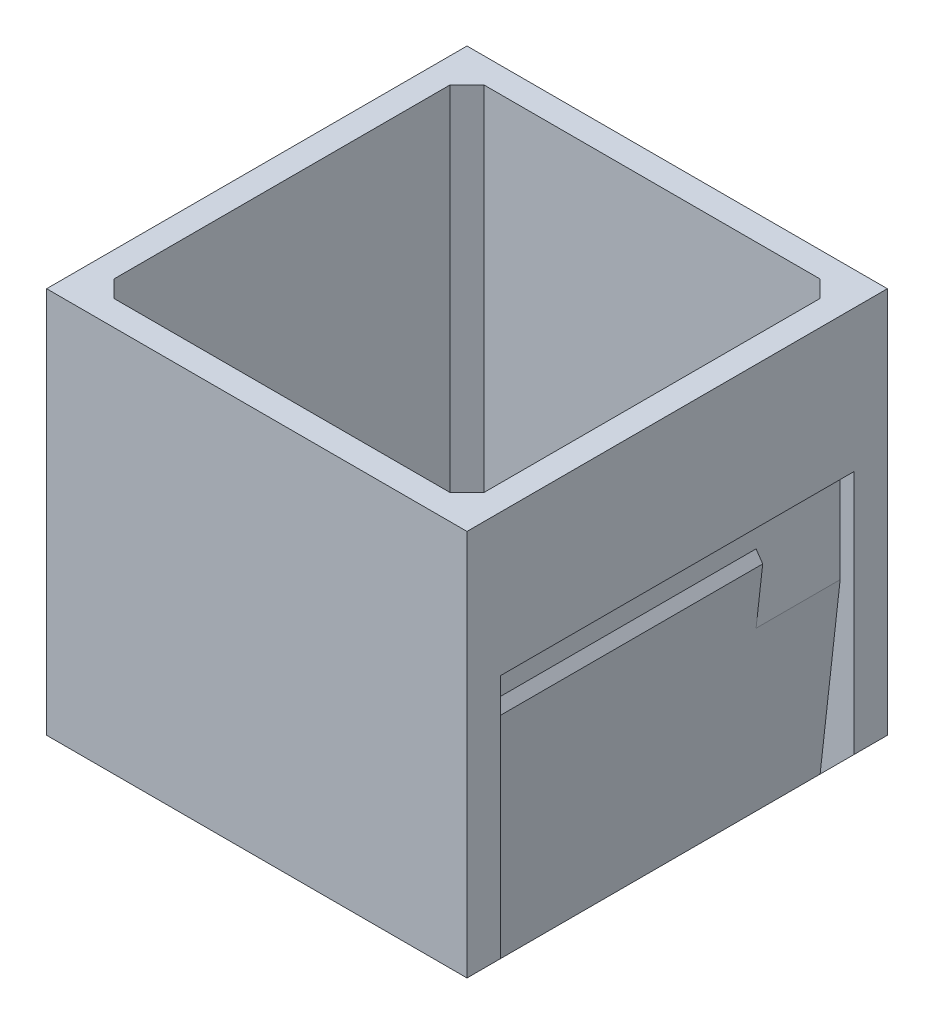
from build123d import *

# Parameters (mm, degrees)
SKIZZE1_W                       = 25
SKIZZE1_H                       = 25
AUFSATZ_LINEAR_AUSTRAGEN1_DEPTH = 25
FASE1_SIZE                      = 2
SCHNITT_LINEAR_START            = -2
SCHNITT_LINEAR_AUSTRAGEN1_DEPTH = 21
WANDUNG1_START                  = -11
WANDUNG1_DEPTH                  = 22
WANDUNG1_START_2                = -12
WANDUNG1_2_DEPTH                = 22
FASE2_SIZE                      = 1
SCHNITT_LINEAR_AUSTRAGEN2_DEPTH = 5


with BuildPart() as part:
    # Skizze1 → Aufsatz-Linear austragen1 (new body)
    with BuildSketch(Plane(origin=(0, 0, 0), x_dir=(1, 0, 0), z_dir=(0, 1, 0))):
        Rectangle(SKIZZE1_W, SKIZZE1_H)
    extrude(amount=AUFSATZ_LINEAR_AUSTRAGEN1_DEPTH)

    # Fase1
    fase1_edges = [part.edges().sort_by_distance(p)[0] for p in [
        (0, 0, 12.5),
        (-12.5, 0, 0),
        (0, 0, -12.5),
        (12.5, 0, 0),
    ]]
    chamfer(fase1_edges, length=FASE1_SIZE)

    # Skizze3 → Schnitt-Linear austragen1 (cut)
    with BuildSketch(Plane.XY.offset(12.5).offset(SCHNITT_LINEAR_START)):
        Polygon((11.691418824, 15.798054248), (11.691418824, 14.698054248), (12.085432918, 14.119124044), (10.5, 0), (12.5, 0), (12.5, 16.576443976), align=None)
    extrude(amount=-SCHNITT_LINEAR_AUSTRAGEN1_DEPTH, mode=Mode.SUBTRACT)

    # Wandung1: read off the stored shape, not the designer's step
    # Wandung1 outline → Wandung1 (cut)
    with BuildSketch(Plane.XY.offset(WANDUNG1_START)):
        Polygon((10.191418824, 14.236037823), (10.191418824, 16.4361557), (11, 17.214545429), (11, 25), (-11, 25), (-11, 2.621320344), (-9.878679656, 1.5), (9.159007508, 1.5), (10.532808529, 13.734429342), align=None)
    extrude(amount=WANDUNG1_DEPTH, mode=Mode.SUBTRACT)

    # Wandung1 2 outline → Wandung1 2 (add)
    with BuildSketch(Plane.YZ.offset(WANDUNG1_START_2)):
        Polygon((2.621320344, -11), (1.5, -9.878679656), (1.5, -11), align=None)
        Polygon((1.5, 9.878679656), (2.621320344, 11), (1.5, 11), align=None)
    extrude(amount=WANDUNG1_2_DEPTH)

    # Fase2
    fase2_edges = [part.edges().sort_by_distance(p)[0] for p in [
        (11, 21.107272714, 11),
        (-11, 13.810660172, 11),
        (-11, 13.810660172, -11),
        (11, 21.107272714, -11),
    ]]
    chamfer(fase2_edges, length=FASE2_SIZE)

    # Skizze4 → Schnitt-Linear austragen2 (cut)
    with BuildSketch(Plane.XY.offset(-10.5)):
        Polygon((11.691418824, 15.798054248), (11.691418824, 11.720195976), (11.691418824, 10.610218801), (10.5, 0), (12.5, 2), (12.5, 16.576443976), align=None)
    extrude(amount=SCHNITT_LINEAR_AUSTRAGEN2_DEPTH, mode=Mode.SUBTRACT)


solid = part.part
